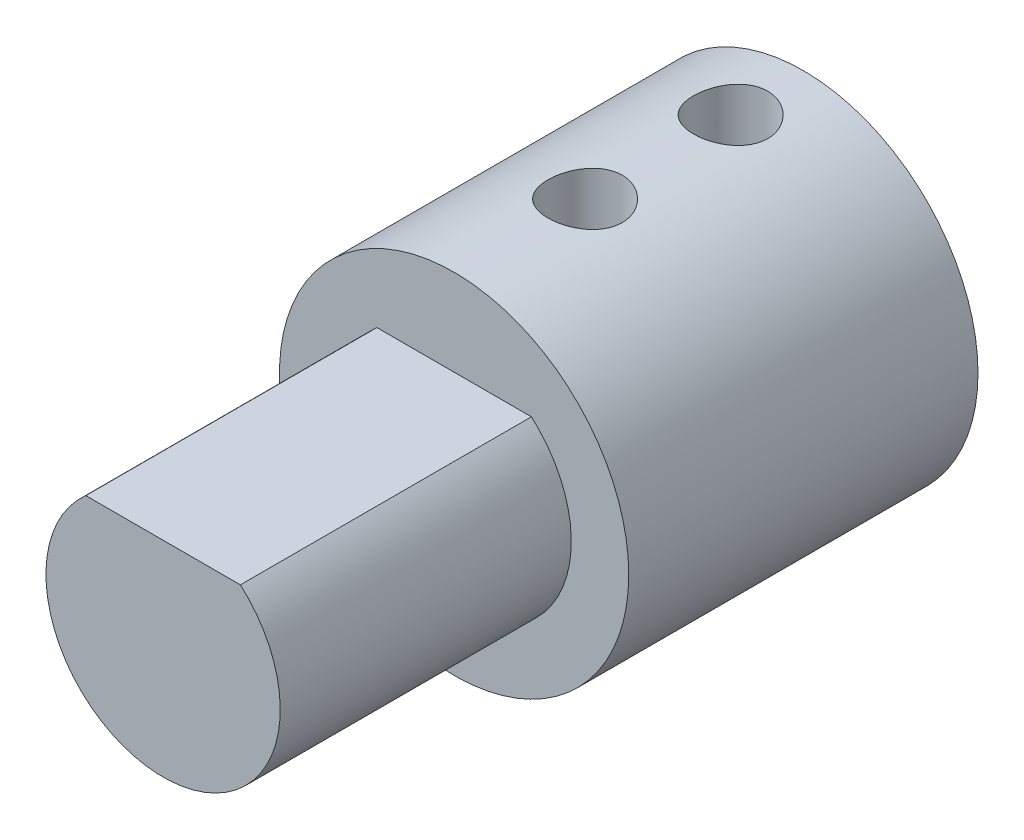
from build123d import *

# Parameters (mm, degrees)
SKETCH1_R           = 6
BOSS_EXTRUDE1_DEPTH = 10
CUT_EXTRUDE1_REACH  = 15.115
SKETCH3_R           = 1.275
SKETCH4_R           = 6
BOSS_EXTRUDE2_DEPTH = 2
BOSS_EXTRUDE3_DEPTH = 10


with BuildPart() as part:
    # Sketch1 → Boss-Extrude1 (new body)
    with BuildSketch(Plane.XY):
        Circle(SKETCH1_R)
        with BuildLine():
            Line((-1.598436736, 1.475), (1.598436736, 1.475))
            ThreePointArc((1.598436736, 1.475), (0, -2.175), (-1.598436736, 1.475))
        make_face(mode=Mode.SUBTRACT)
    extrude(amount=BOSS_EXTRUDE1_DEPTH)

    # Sketch3 → Cut-Extrude1 (cut, up to next)
    with BuildSketch(Plane(origin=(0, 0, 0), x_dir=(1, 0, 0), z_dir=(0, 1, 0)), mode=Mode.PRIVATE) as cut_extrude1_sk1:
        with Locations((0, -2.5)):
            Circle(SKETCH3_R)
    cut_extrude1_tool1 = extrude(cut_extrude1_sk1.sketch, amount=CUT_EXTRUDE1_REACH, mode=Mode.PRIVATE) & part.part
    # Sketch3 → Cut-Extrude1 (cut, up to next)
    with BuildSketch(Plane(origin=(0, 0, 0), x_dir=(1, 0, 0), z_dir=(0, 1, 0)), mode=Mode.PRIVATE) as cut_extrude1_sk2:
        with Locations((0, -7.5)):
            Circle(SKETCH3_R)
    cut_extrude1_tool2 = extrude(cut_extrude1_sk2.sketch, amount=CUT_EXTRUDE1_REACH, mode=Mode.PRIVATE) & part.part
    add(cut_extrude1_tool1.solids().sort_by_distance((0, 0, 2.5))[0], mode=Mode.SUBTRACT)
    add(cut_extrude1_tool2.solids().sort_by_distance((0, 0, 7.5))[0], mode=Mode.SUBTRACT)

    # Sketch4 → Boss-Extrude2 (add)
    with BuildSketch(Plane.XY.offset(10)):
        Circle(SKETCH4_R)
    extrude(amount=BOSS_EXTRUDE2_DEPTH)

    # Sketch6 → Boss-Extrude3 (add)
    with BuildSketch(Plane.XY.offset(12)):
        with BuildLine():
            Line((2.655183609, 3.025), (-2.655183609, 3.025))
            ThreePointArc((-2.655183609, 3.025), (-1.660348001, -3.666588266), (4.025, 0))
            ThreePointArc((4.025, 0), (3.666588266, 1.660348001), (2.655183609, 3.025))
        make_face()
    extrude(amount=BOSS_EXTRUDE3_DEPTH)


solid = part.part
